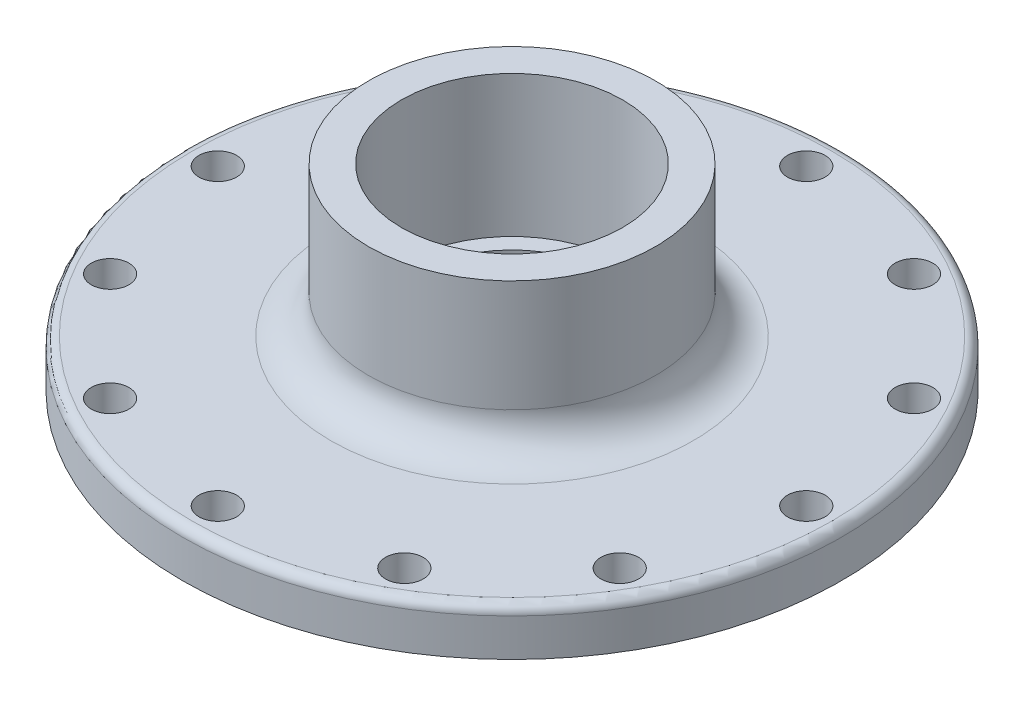
from build123d import *

# Parameters (mm, degrees)
F_8_0MM_DOWEL_HOLE2_D = 8


with BuildPart() as part:
    # Sketch1 → Revolve1 (revolve)
    with BuildSketch(Plane.XY):
        with BuildLine():
            Line((-70, -26.698290186), (-45, -26.698290186))
            Line((-45, -26.698290186), (-45, -31.698290186))
            Line((-45, -31.698290186), (-40, -31.698290186))
            Line((-40, -31.698290186), (-40, -26.698290186))
            Line((-40, -26.698290186), (-20, -26.698290186))
            Line((-20, -26.698290186), (-20, -14.981775429))
            Line((-20, -14.981775429), (-23.5, -14.981775429))
            Line((-23.5, -14.981775429), (-23.5, 15.018224571))
            Line((-23.5, 15.018224571), (-30.5, 15.018224571))
            Line((-30.5, 15.018224571), (-30.5, -8.698290186))
            ThreePointArc((-30.5, -8.698290186), (-32.843145751, -14.355144435), (-38.5, -16.698290186))
            Line((-38.5, -16.698290186), (-68, -16.698290186))
            ThreePointArc((-68, -16.698290186), (-69.414213562, -17.284076623), (-70, -18.698290186))
            Line((-70, -18.698290186), (-70, -26.698290186))
        make_face()
    revolve(axis=Axis((0, 95.786399453, 0), (0, -1, 0)))

    # Ø8.0mm Dowel Hole2 (through all)
    with Locations(Plane(origin=(0, -16.698290186, 0), x_dir=(1, 0, 0), z_dir=(0, 1, 0))):
        with Locations((-31.25, 54.126587737), (0, 62.5), (31.25, 54.126587737), (54.126587737, 31.25), (62.5, 0), (54.126587737, -31.25), (31.25, -54.126587737), (0, -62.5), (-31.25, -54.126587737), (-54.126587737, -31.25), (-62.5, 0), (-54.126587737, 31.25)):
            Hole(F_8_0MM_DOWEL_HOLE2_D / 2)


solid = part.part
